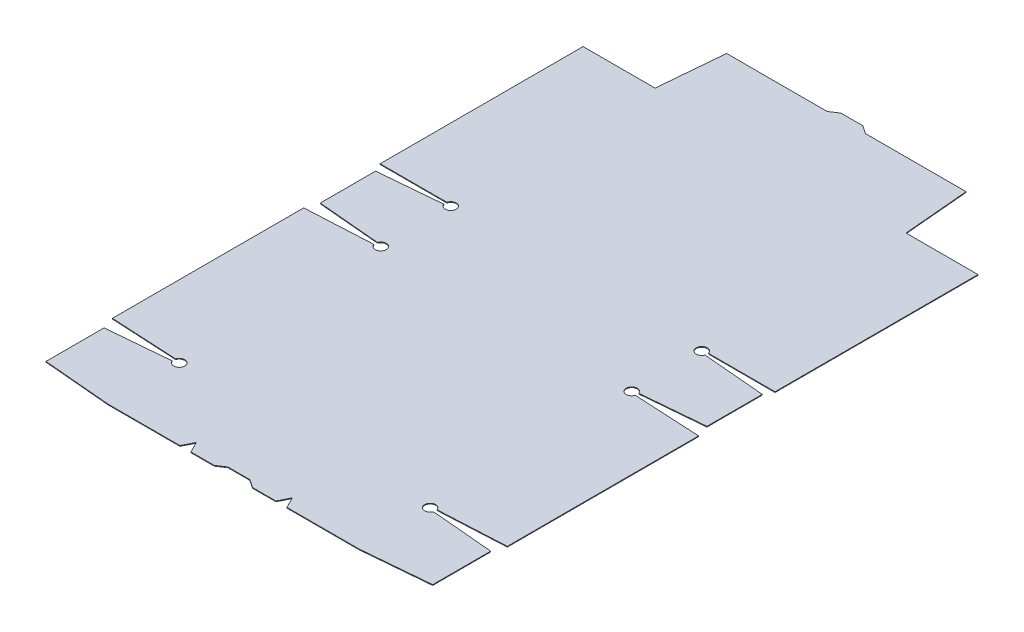
from build123d import *

# Parameters (mm, degrees)
EXTRUDE1_DEPTH = 0.79375
EXTRUDE2_REACH = 567.04
SKETCH2_R      = 6.35
EXTRUDE3_REACH = 567.04
EXTRUDE4_REACH = 567.04


with BuildPart() as part:
    # Sketch1 → Extrude1 (new body)
    with BuildSketch(Plane(origin=(0, 0, 0), x_dir=(1, 0, 0), z_dir=(0, 1, 0))):
        with BuildLine():
            Line((145.25625, 434.18125), (138.034060826, 516.73125))
            Line((138.034060826, 516.73125), (-138.034060826, 516.73125))
            Line((-138.034060826, 516.73125), (-145.25625, 434.18125))
            Line((-145.25625, 434.18125), (-228.6, 434.18125))
            Line((-228.6, 434.18125), (-228.6, 199.23125))
            Line((-228.6, 199.23125), (-145.25625, 199.23125))
            ThreePointArc((-145.25625, 199.23125), (-143.670260948, 197.712995777), (-145.117890258, 196.062290917))
            Line((-145.117890258, 196.062290917), (-223.8375, 189.175217467))
            Line((-223.8375, 189.175217467), (-223.8375, 125.149782533))
            Line((-223.8375, 125.149782533), (-145.117890258, 118.262709083))
            ThreePointArc((-145.117890258, 118.262709083), (-143.668991784, 116.653544305), (-145.173166669, 115.095925614))
            Line((-145.173166669, 115.095925614), (-228.6, 110.723710546))
            Line((-228.6, 110.723710546), (-228.6, -110.723710546))
            Line((-228.6, -110.723710546), (-145.173166669, -115.095925614))
            ThreePointArc((-145.173166669, -115.095925614), (-143.668991784, -116.653544305), (-145.117890258, -118.262709083))
            Line((-145.117890258, -118.262709083), (-223.8375, -125.149782533))
            Line((-223.8375, -125.149782533), (-223.8375, -192.356281459))
            Line((-223.8375, -192.356281459), (-145.25625, -199.23125))
            Line((-145.25625, -199.23125), (145.25625, -199.23125))
            Line((145.25625, -199.23125), (223.8375, -192.356281459))
            Line((223.8375, -192.356281459), (223.8375, -125.149782533))
            Line((223.8375, -125.149782533), (145.117890258, -118.262709083))
            ThreePointArc((145.117890258, -118.262709083), (143.668991784, -116.653544305), (145.173166669, -115.095925614))
            Line((145.173166669, -115.095925614), (228.6, -110.723710546))
            Line((228.6, -110.723710546), (228.6, 110.723710546))
            Line((228.6, 110.723710546), (145.173166669, 115.095925614))
            ThreePointArc((145.173166669, 115.095925614), (143.668991784, 116.653544305), (145.117890258, 118.262709083))
            Line((145.117890258, 118.262709083), (223.8375, 125.149782533))
            Line((223.8375, 125.149782533), (223.8375, 189.175217467))
            Line((223.8375, 189.175217467), (145.117890258, 196.062290917))
            ThreePointArc((145.117890258, 196.062290917), (143.670260948, 197.712995777), (145.25625, 199.23125))
            Line((145.25625, 199.23125), (228.6, 199.23125))
            Line((228.6, 199.23125), (228.6, 434.18125))
            Line((228.6, 434.18125), (145.25625, 434.18125))
        make_face()
    extrude(amount=EXTRUDE1_DEPTH)

    # Sketch2 → Extrude2 (cut, up to next)
    with BuildSketch(Plane(origin=(0, 0.79375, 0), x_dir=(1, 0, 0), z_dir=(0, 1, 0)), mode=Mode.PRIVATE) as extrude2_sk1:
        with Locations((-145.25625, 116.68125)):
            Circle(SKETCH2_R)
    extrude2_tool1 = extrude(extrude2_sk1.sketch, amount=-EXTRUDE2_REACH, mode=Mode.PRIVATE) & part.part
    # Sketch2 → Extrude2 (cut, up to next)
    with BuildSketch(Plane(origin=(0, 0.79375, 0), x_dir=(1, 0, 0), z_dir=(0, 1, 0)), mode=Mode.PRIVATE) as extrude2_sk2:
        with Locations((-145.25625, -116.68125)):
            Circle(SKETCH2_R)
    extrude2_tool2 = extrude(extrude2_sk2.sketch, amount=-EXTRUDE2_REACH, mode=Mode.PRIVATE) & part.part
    # Sketch2 → Extrude2 (cut, up to next)
    with BuildSketch(Plane(origin=(0, 0.79375, 0), x_dir=(1, 0, 0), z_dir=(0, 1, 0)), mode=Mode.PRIVATE) as extrude2_sk3:
        with Locations((145.25625, -116.68125)):
            Circle(SKETCH2_R)
    extrude2_tool3 = extrude(extrude2_sk3.sketch, amount=-EXTRUDE2_REACH, mode=Mode.PRIVATE) & part.part
    # Sketch2 → Extrude2 (cut, up to next)
    with BuildSketch(Plane(origin=(0, 0.79375, 0), x_dir=(1, 0, 0), z_dir=(0, 1, 0)), mode=Mode.PRIVATE) as extrude2_sk4:
        with Locations((145.25625, 116.68125)):
            Circle(SKETCH2_R)
    extrude2_tool4 = extrude(extrude2_sk4.sketch, amount=-EXTRUDE2_REACH, mode=Mode.PRIVATE) & part.part
    # Sketch2 → Extrude2 (cut, up to next)
    with BuildSketch(Plane(origin=(0, 0.79375, 0), x_dir=(1, 0, 0), z_dir=(0, 1, 0)), mode=Mode.PRIVATE) as extrude2_sk5:
        with Locations((-145.25625, 197.64375)):
            Circle(SKETCH2_R)
    extrude2_tool5 = extrude(extrude2_sk5.sketch, amount=-EXTRUDE2_REACH, mode=Mode.PRIVATE) & part.part
    # Sketch2 → Extrude2 (cut, up to next)
    with BuildSketch(Plane(origin=(0, 0.79375, 0), x_dir=(1, 0, 0), z_dir=(0, 1, 0)), mode=Mode.PRIVATE) as extrude2_sk6:
        with Locations((145.25625, 197.64375)):
            Circle(SKETCH2_R)
    extrude2_tool6 = extrude(extrude2_sk6.sketch, amount=-EXTRUDE2_REACH, mode=Mode.PRIVATE) & part.part
    add(extrude2_tool1.solids().sort_by_distance((-145.25625, 0.79375, -116.68125))[0], mode=Mode.SUBTRACT)
    add(extrude2_tool2.solids().sort_by_distance((-145.25625, 0.79375, 116.68125))[0], mode=Mode.SUBTRACT)
    add(extrude2_tool3.solids().sort_by_distance((145.25625, 0.79375, 116.68125))[0], mode=Mode.SUBTRACT)
    add(extrude2_tool4.solids().sort_by_distance((145.25625, 0.79375, -116.68125))[0], mode=Mode.SUBTRACT)
    add(extrude2_tool5.solids().sort_by_distance((-145.25625, 0.79375, -197.64375))[0], mode=Mode.SUBTRACT)
    add(extrude2_tool6.solids().sort_by_distance((145.25625, 0.79375, -197.64375))[0], mode=Mode.SUBTRACT)

    # Sketch12 → Extrude3 (cut, up to next)
    with BuildSketch(Plane(origin=(0, 0.79375, 0), x_dir=(1, 0, 0), z_dir=(0, 1, 0)), mode=Mode.PRIVATE) as extrude3_sk1:
        Polygon((-138.589613839, 510.38125), (-22.225, 510.38125), (-12.7, 516.73125), (-138.034060826, 516.73125), align=None)
    extrude3_tool1 = extrude(extrude3_sk1.sketch, amount=-EXTRUDE3_REACH, mode=Mode.PRIVATE) & part.part
    # Sketch12 → Extrude3 (cut, up to next)
    with BuildSketch(Plane(origin=(0, 0.79375, 0), x_dir=(1, 0, 0), z_dir=(0, 1, 0)), mode=Mode.PRIVATE) as extrude3_sk2:
        Polygon((12.7, 516.73125), (22.225, 510.38125), (138.589613839, 510.38125), (138.034060826, 516.73125), align=None)
    extrude3_tool2 = extrude(extrude3_sk2.sketch, amount=-EXTRUDE3_REACH, mode=Mode.PRIVATE) & part.part
    add(extrude3_tool1.solids().sort_by_distance((-77.855995, 0.79375, -513.595525))[0], mode=Mode.SUBTRACT)
    add(extrude3_tool2.solids().sort_by_distance((77.855995, 0.79375, -513.595525))[0], mode=Mode.SUBTRACT)

    # Sketch13 → Extrude4 (cut, up to next)
    with BuildSketch(Plane(origin=(0, 0.79375, 0), x_dir=(1, 0, 0), z_dir=(0, 1, 0)), mode=Mode.PRIVATE) as extrude4_sk1:
        Polygon((-61.9125, -199.23125), (-55.5625, -186.53125), (-49.2125, -199.23125), align=None)
    extrude4_tool1 = extrude(extrude4_sk1.sketch, amount=-EXTRUDE4_REACH, mode=Mode.PRIVATE) & part.part
    # Sketch13 → Extrude4 (cut, up to next)
    with BuildSketch(Plane(origin=(0, 0.79375, 0), x_dir=(1, 0, 0), z_dir=(0, 1, 0)), mode=Mode.PRIVATE) as extrude4_sk2:
        Polygon((49.2125, -199.23125), (55.5625, -186.53125), (61.9125, -199.23125), align=None)
    extrude4_tool2 = extrude(extrude4_sk2.sketch, amount=-EXTRUDE4_REACH, mode=Mode.PRIVATE) & part.part
    # Sketch13 → Extrude4 (cut, up to next)
    with BuildSketch(Plane(origin=(0, 0.79375, 0), x_dir=(1, 0, 0), z_dir=(0, 1, 0)), mode=Mode.PRIVATE) as extrude4_sk3:
        Polygon((-22.225, -199.23125), (-12.7, -192.88125), (12.7, -192.88125), (22.225, -199.23125), align=None)
    extrude4_tool3 = extrude(extrude4_sk3.sketch, amount=-EXTRUDE4_REACH, mode=Mode.PRIVATE) & part.part
    add(extrude4_tool1.solids().sort_by_distance((-55.5625, 0.79375, 194.997917))[0], mode=Mode.SUBTRACT)
    add(extrude4_tool2.solids().sort_by_distance((55.5625, 0.79375, 194.997917))[0], mode=Mode.SUBTRACT)
    add(extrude4_tool3.solids().sort_by_distance((0, 0.79375, 196.344886))[0], mode=Mode.SUBTRACT)


solid = part.part
